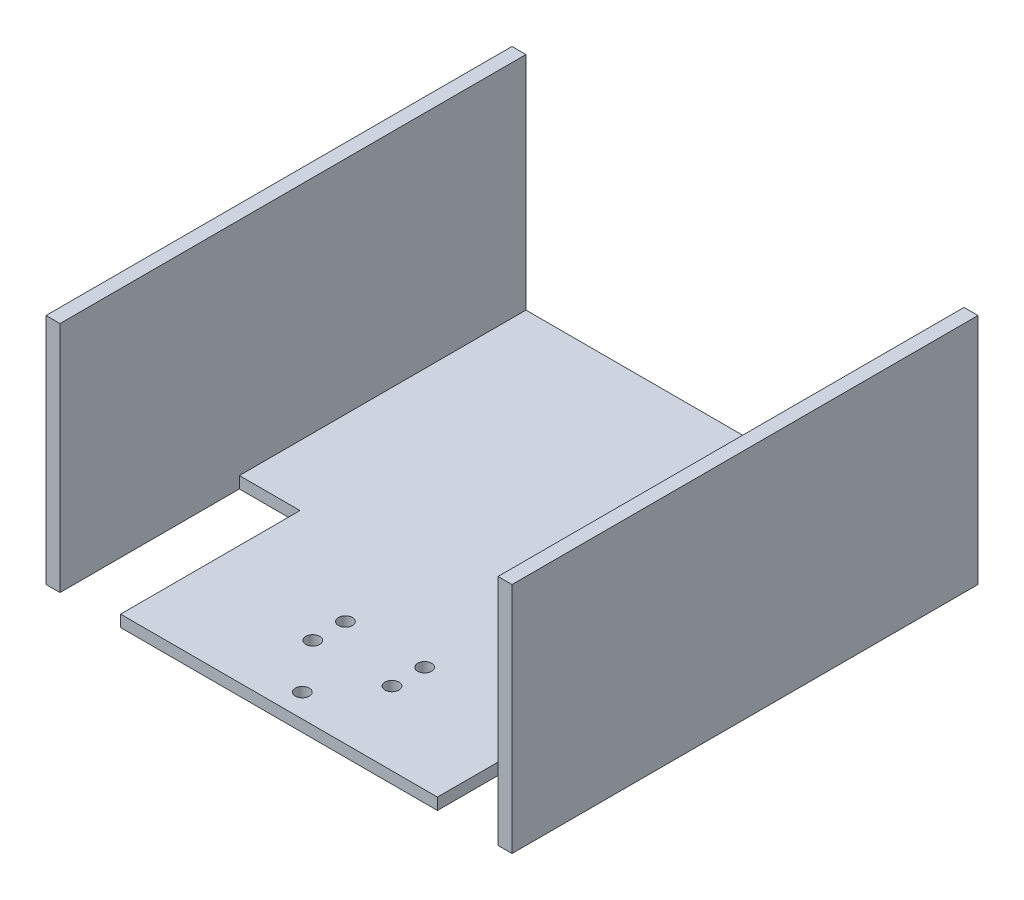
from build123d import *

# Parameters (mm, degrees)
SALIENTE_EXTRUIR1_DEPTH = 100
CROQUIS2_W              = 13
CROQUIS2_H              = 38.5
CORTAR_EXTRUIR2_DEPTH   = 10
CROQUIS3_R              = 1.5
CORTAR_EXTRUIR3_DEPTH   = 5
CROQUIS4_R              = 1.5
CORTAR_EXTRUIR4_DEPTH   = 10


with BuildPart() as part:
    # Croquis1 → Saliente-Extruir1 (new body)
    with BuildSketch(Plane.XY):
        Polygon((50, 0), (-50, 0), (-50, 50), (-47, 50), (-47, 2.5), (47, 2.5), (47, 50), (50, 50), align=None)
    extrude(amount=-SALIENTE_EXTRUIR1_DEPTH)

    # Croquis2 → Cortar-Extruir2 (cut)
    with BuildSketch(Plane(origin=(0, 2.5, 0), x_dir=(1, 0, 0), z_dir=(0, 1, 0))):
        with Locations((-40.5, 19.25)):
            Rectangle(CROQUIS2_W, CROQUIS2_H)
        with Locations((40.5, 19.25)):
            Rectangle(CROQUIS2_W, CROQUIS2_H)
    extrude(amount=-CORTAR_EXTRUIR2_DEPTH, mode=Mode.SUBTRACT)

    # Croquis3 → Cortar-Extruir3 (cut)
    with BuildSketch(Plane(origin=(0, 2.5, 0), x_dir=(1, 0, 0), z_dir=(0, 1, 0))):
        with Locations((0, 5)):
            Circle(CROQUIS3_R)
    extrude(amount=-CORTAR_EXTRUIR3_DEPTH, mode=Mode.SUBTRACT)

    # Croquis4 → Cortar-Extruir4 (cut)
    with BuildSketch(Plane(origin=(0, 2.5, 0), x_dir=(1, 0, 0), z_dir=(0, 1, 0))):
        with Locations((-8.5, 22.75)):
            Circle(CROQUIS4_R)
        with Locations((-8.5, 15.75)):
            Circle(CROQUIS4_R)
        with Locations((8.5, 15.75)):
            Circle(CROQUIS4_R)
        with Locations((8.5, 22.75)):
            Circle(CROQUIS4_R)
    extrude(amount=-CORTAR_EXTRUIR4_DEPTH, mode=Mode.SUBTRACT)


solid = part.part
